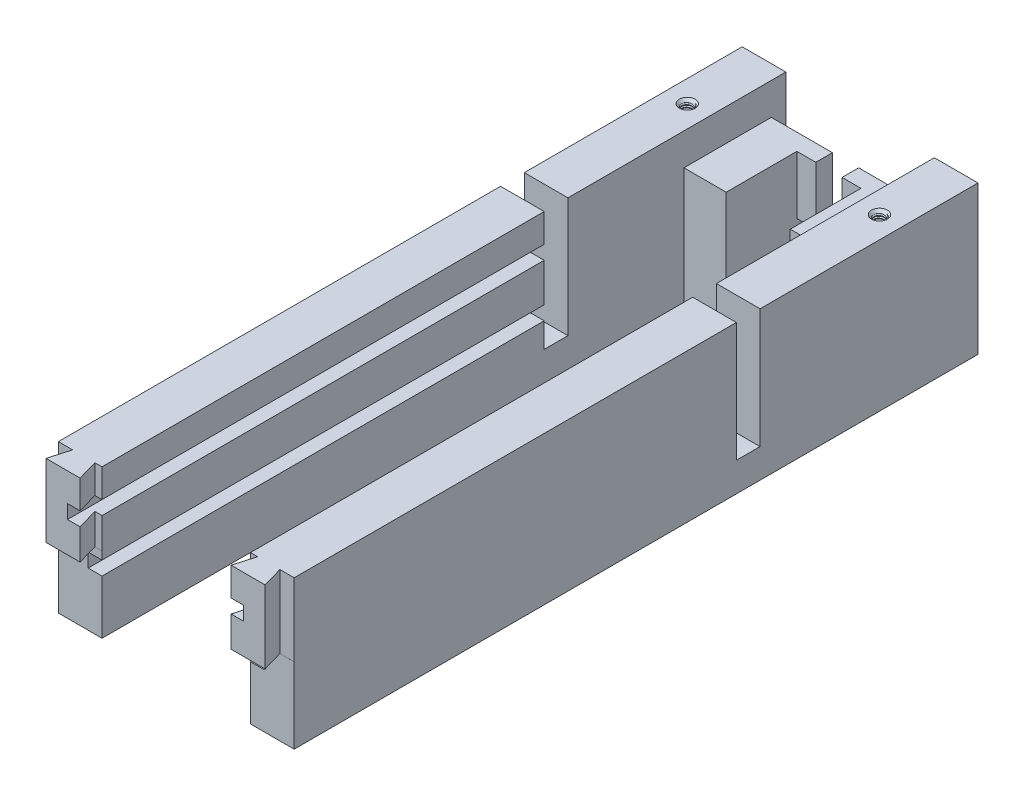
from build123d import *

# Parameters (mm, degrees)
SKETCH1_W                      = 242
SKETCH1_H                      = 51
BOSS_EXTRUDE1_DEPTH            = 15
SKETCH26_W                     = 30
SKETCH26_H                     = 40
BOSS_EXTRUDE3_DEPTH            = 29.5
SKETCH28_W                     = 15
SKETCH28_H                     = 9.75
BOSS_EXTRUDE5_DEPTH            = 4.5
SKETCH29_W                     = 5.7
SKETCH29_H                     = 20
BOSS_EXTRUDE6_DEPTH            = 6.5
CUT_EXTRUDE8_DEPTH             = 25
SKETCH13_W                     = 15
SKETCH13_H                     = 7.11
CUT_EXTRUDE9_DEPTH             = 26
SKETCH17_W                     = 15
SKETCH17_H                     = 8.15
CUT_EXTRUDE10_DEPTH            = 41
SKETCH7_W                      = 4.75
SKETCH7_H                      = 4.75
CUT_EXTRUDE5_DEPTH             = 165
F_8_32_TAPPED_HOLE1_AT_2_COUNT = 2
F_8_32_TAPPED_HOLE1_AT_2_PITCH = 66
THREAD3_PITCH                  = 0.79375
THREAD4_PITCH                  = 0.79375


with BuildPart() as part:
    # Sketch1 → Boss-Extrude1 (new body)
    with BuildSketch(Plane(origin=(0, 0, 0), x_dir=(0, 0, -1), z_dir=(1, 0, 0))):
        with Locations((56.437921078, 5.057266603)):
            Rectangle(SKETCH1_W, SKETCH1_H)
    extrude(amount=BOSS_EXTRUDE1_DEPTH)

    # Sketch26 → Boss-Extrude3 (add)
    with BuildSketch(Plane.ZY):
        with Locations((-157.437921078, -0.442733397)):
            Rectangle(SKETCH26_W, SKETCH26_H)
    extrude(amount=-BOSS_EXTRUDE3_DEPTH)

    # Sketch28 → Boss-Extrude5 (add)
    with BuildSketch(Plane(origin=(29.5, 0, 0), x_dir=(0, 0, -1), z_dir=(1, 0, 0))):
        with Locations((154.541661602, -15.567733397)):
            Rectangle(SKETCH28_W, SKETCH28_H)
    extrude(amount=BOSS_EXTRUDE5_DEPTH)

    # Sketch29 → Boss-Extrude6 (add)
    with BuildSketch(Plane(origin=(29.5, 0, 0), x_dir=(0, 0, -1), z_dir=(1, 0, 0))):
        with Locations((169.587921078, 9.557266603)):
            Rectangle(SKETCH29_W, SKETCH29_H)
    extrude(amount=BOSS_EXTRUDE6_DEPTH)

    # Sketch12 → Cut-Extrude8 (cut)
    with BuildSketch(Plane(origin=(0, 30.557266603, 0), x_dir=(1, 0, 0), z_dir=(0, 1, 0))):
        Polygon((0, -57.448742372), (4.909716433, -57.448742372), (2.87, -64.562078922), (0, -64.562078922), align=None)
        Polygon((15, -57.448742372), (15, -64.562078922), (14.57, -64.562078922), (12.530283567, -57.448742372), align=None)
    extrude(amount=-CUT_EXTRUDE8_DEPTH, mode=Mode.SUBTRACT)

    # Sketch13 → Cut-Extrude9 (cut)
    with BuildSketch(Plane.XZ.offset(20.442733397)):
        with Locations((7.5, 61.007078922)):
            Rectangle(SKETCH13_W, SKETCH13_H)
    extrude(amount=-CUT_EXTRUDE9_DEPTH, mode=Mode.SUBTRACT)

    # Sketch17 → Cut-Extrude10 (cut)
    with BuildSketch(Plane(origin=(0, 30.557266603, 0), x_dir=(1, 0, 0), z_dir=(0, 1, 0))):
        with Locations((7.5, 98.512921078)):
            Rectangle(SKETCH17_W, SKETCH17_H)
    extrude(amount=-CUT_EXTRUDE10_DEPTH, mode=Mode.SUBTRACT)

    # Sketch7 → Cut-Extrude5 (cut)
    with BuildSketch(Plane(origin=(0, 0, -94.437921078), x_dir=(-1, 0, 0), z_dir=(0, 0, -1))):
        with Locations((-12.625, 0.432266603)):
            Rectangle(SKETCH7_W, SKETCH7_H)
        with Locations((-12.625, 18.432266603)):
            Rectangle(SKETCH7_W, SKETCH7_H)
    extrude(amount=-CUT_EXTRUDE5_DEPTH, mode=Mode.SUBTRACT)


with BuildPart() as body_2:
    # Mirror4: mirrored copy
    add(part.part.mirror(Plane(origin=(40.5, 0, 0), x_dir=(0, 0, 1), z_dir=(1, 0, 0))))


with BuildPart() as part_1:
    add(part.part)

    # Sketch37 → #8-32 Tapped Hole1 (revolve, cut)
    with BuildSketch(Plane(origin=(7.5, 30.557266603, -151.078683634), x_dir=(0, 0, 1), z_dir=(1, 0, 0))):
        Polygon((0, 0), (0, 10.70744), (1.7272, 9.669633539), (1.7272, 0.9906), (2.7178, 0), align=None)
    f_8_32_tapped_hole1 = revolve(axis=Axis((7.5, 36.907266603, -151.078683634), (0, -1, 0)), mode=Mode.SUBTRACT)

    # Thread3: the profile of Thread Profile5 profile screwed along a right-hand helix of 12.598425 turns, 8 arcs to a turn; built about Z, then put on its axis
    thread3_z = Axis((0, 0, 0), (0, 0, 1))
    thread3_corners = [(1.7269, 0, -0.000173205), (2.156829788, 0, 0.248046874), (2.156829788, 0, 0.347265624), (1.7269, 0, 0.595485703)]
    with BuildLine(mode=Mode.PRIVATE) as thread3_profile:
        Line(thread3_corners[0], thread3_corners[1])
        Line(thread3_corners[1], thread3_corners[2])
        Line(thread3_corners[2], thread3_corners[3])
        Line(thread3_corners[3], thread3_corners[0])
    thread3_cap = Face(thread3_profile.wire())
    thread3_turn_angles = [0, 22.5, 45, 67.5, 90, 112.5, 135, 157.5, 180, 202.5, 225, 247.5, 270, 292.5, 315, 337.5, 360]
    thread3_turn_weights = [1, 0.9238795325112867, 1, 0.9238795325112867, 1, 0.9238795325112867, 1, 0.9238795325112867, 1, 0.9238795325112867, 1, 0.9238795325112867, 1, 0.9238795325112867, 1, 0.9238795325112867, 1]
    thread3_turn_rails = [Edge.make_bspline([Vector(p[0], p[1], 0).rotate(thread3_z, thread3_turn_angles[k]) / thread3_turn_weights[k] + Vector(0, 0, p[2] + THREAD3_PITCH * thread3_turn_angles[k] / 360) for k in range(17)], [0, 0, 0, 1, 1, 2, 2, 3, 3, 4, 4, 5, 5, 6, 6, 7, 7, 8, 8, 8], 2, thread3_turn_weights) for p in thread3_corners]
    thread3_turn_sides = [Face.make_surface_from_curves(thread3_turn_rails[p[0]], thread3_turn_rails[p[1]]) for p in [(0, 1), (1, 2), (2, 3), (3, 0)]]
    thread3_last_angles = [4320, 4342.5, 4365, 4387.5, 4410, 4432.5, 4455, 4477.5, 4500, 4517.716535433, 4535.433070866]
    thread3_last_weights = [1, 0.9238795325112867, 1, 0.9238795325112867, 1, 0.9238795325112867, 1, 0.9238795325112867, 1, 0.9525736983244454, 1]
    thread3_last_rails = [Edge.make_bspline([Vector(p[0], p[1], 0).rotate(thread3_z, thread3_last_angles[k]) / thread3_last_weights[k] + Vector(0, 0, p[2] + THREAD3_PITCH * thread3_last_angles[k] / 360) for k in range(11)], [0, 0, 0, 1, 1, 2, 2, 3, 3, 4, 4, 5, 5, 5], 2, thread3_last_weights) for p in thread3_corners]
    thread3_last_sides = [Face.make_surface_from_curves(thread3_last_rails[p[0]], thread3_last_rails[p[1]]) for p in [(0, 1), (1, 2), (2, 3), (3, 0)]]
    thread3 = Plane(origin=(7.5, 30.566666603, -151.078683634), x_dir=(-1, 0, 0), z_dir=(0, -1, 0)) * Solid(Shell([*[p.moved(Location((0, 0, THREAD3_PITCH * i))) for i in range(12) for p in thread3_turn_sides], *thread3_last_sides, thread3_cap, thread3_cap.rotate(thread3_z, 4535.433070866).moved(Location((0, 0, THREAD3_PITCH * 4535.433070866 / 360)))]))
    add(thread3, mode=Mode.SUBTRACT)


with BuildPart() as body_2_1:
    add(body_2.part)

    # #8-32 Tapped Hole1 at 2: #8-32 Tapped Hole1 ×2
    with Locations(*[(i * F_8_32_TAPPED_HOLE1_AT_2_PITCH, 0, 0) for i in range(1, F_8_32_TAPPED_HOLE1_AT_2_COUNT)]):
        add(f_8_32_tapped_hole1, mode=Mode.SUBTRACT)

    # Thread4: the profile of Thread Profile6 profile screwed along a right-hand helix of 12.598425 turns, 8 arcs to a turn; built about Z, then put on its axis
    thread4_z = Axis((0, 0, 0), (0, 0, 1))
    thread4_corners = [(1.7269, 0, -0.000173205), (2.156829788, 0, 0.248046874), (2.156829788, 0, 0.347265624), (1.7269, 0, 0.595485703)]
    with BuildLine(mode=Mode.PRIVATE) as thread4_profile:
        Line(thread4_corners[0], thread4_corners[1])
        Line(thread4_corners[1], thread4_corners[2])
        Line(thread4_corners[2], thread4_corners[3])
        Line(thread4_corners[3], thread4_corners[0])
    thread4_cap = Face(thread4_profile.wire())
    thread4_turn_angles = [0, 22.5, 45, 67.5, 90, 112.5, 135, 157.5, 180, 202.5, 225, 247.5, 270, 292.5, 315, 337.5, 360]
    thread4_turn_weights = [1, 0.9238795325112867, 1, 0.9238795325112867, 1, 0.9238795325112867, 1, 0.9238795325112867, 1, 0.9238795325112867, 1, 0.9238795325112867, 1, 0.9238795325112867, 1, 0.9238795325112867, 1]
    thread4_turn_rails = [Edge.make_bspline([Vector(p[0], p[1], 0).rotate(thread4_z, thread4_turn_angles[k]) / thread4_turn_weights[k] + Vector(0, 0, p[2] + THREAD4_PITCH * thread4_turn_angles[k] / 360) for k in range(17)], [0, 0, 0, 1, 1, 2, 2, 3, 3, 4, 4, 5, 5, 6, 6, 7, 7, 8, 8, 8], 2, thread4_turn_weights) for p in thread4_corners]
    thread4_turn_sides = [Face.make_surface_from_curves(thread4_turn_rails[p[0]], thread4_turn_rails[p[1]]) for p in [(0, 1), (1, 2), (2, 3), (3, 0)]]
    thread4_last_angles = [4320, 4342.5, 4365, 4387.5, 4410, 4432.5, 4455, 4477.5, 4500, 4517.716535433, 4535.433070866]
    thread4_last_weights = [1, 0.9238795325112867, 1, 0.9238795325112867, 1, 0.9238795325112867, 1, 0.9238795325112867, 1, 0.9525736983244454, 1]
    thread4_last_rails = [Edge.make_bspline([Vector(p[0], p[1], 0).rotate(thread4_z, thread4_last_angles[k]) / thread4_last_weights[k] + Vector(0, 0, p[2] + THREAD4_PITCH * thread4_last_angles[k] / 360) for k in range(11)], [0, 0, 0, 1, 1, 2, 2, 3, 3, 4, 4, 5, 5, 5], 2, thread4_last_weights) for p in thread4_corners]
    thread4_last_sides = [Face.make_surface_from_curves(thread4_last_rails[p[0]], thread4_last_rails[p[1]]) for p in [(0, 1), (1, 2), (2, 3), (3, 0)]]
    thread4 = Plane(origin=(73.5, 30.566666603, -151.078683634), x_dir=(-1, 0, 0), z_dir=(0, -1, 0)) * Solid(Shell([*[p.moved(Location((0, 0, THREAD4_PITCH * i))) for i in range(12) for p in thread4_turn_sides], *thread4_last_sides, thread4_cap, thread4_cap.rotate(thread4_z, 4535.433070866).moved(Location((0, 0, THREAD4_PITCH * 4535.433070866 / 360)))]))
    add(thread4, mode=Mode.SUBTRACT)


solid = Compound([part_1.part, body_2_1.part])
